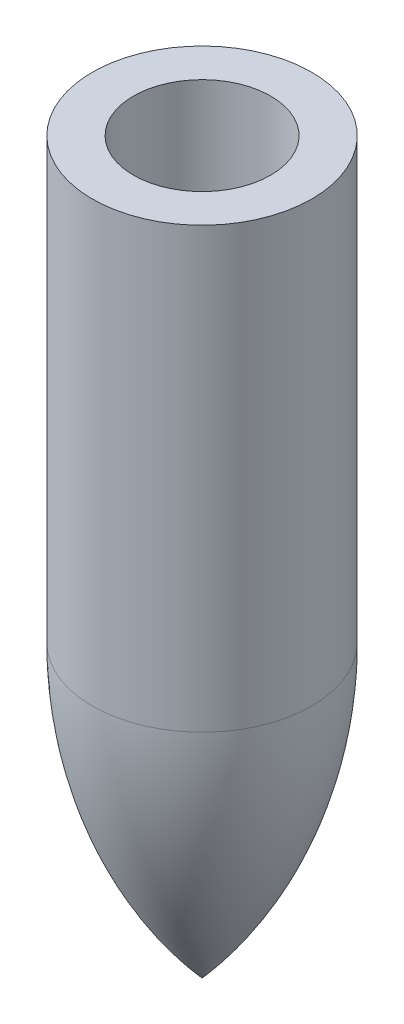
from build123d import *


# Read off the part's stored shape, not the designer's step: Shell2
with BuildPart() as part:
    # Sketch1 → Revolve1 (revolve)
    with BuildSketch(Plane.XY, mode=Mode.PRIVATE) as revolve1_sk:
        with BuildLine():
            Line((0, 0), (0, -50.8))
            ThreePointArc((0, -50.8), (3.280951188, -68.760512242), (12.7, -84.401041651))
            Line((12.7, -84.401041651), (12.7, 0))
            Line((12.7, 0), (0, 0))
        make_face()
    revolve(revolve1_sk.sketch.rotate(Axis((12.7, -84.401041651, 0), (0, 1, 0)), 180), axis=Axis((12.7, -84.401041651, 0), (0, 1, 0)))

    # Shell2 outline → Shell2 (revolve, cut)
    with BuildSketch(Plane(origin=(12.7, 0, 0), x_dir=(1, 0, 0), z_dir=(0, 0, 1))):
        with BuildLine():
            Line((0, 0), (0, -76.642627696))
            add(Edge.make_bspline(
                [(7.9375, -50.8), (7.9375, -64.940305721), (0, -76.642627696)],
                knots=[0, 0, 0, 0.596002439, 0.596002439, 0.596002439], degree=2, weights=[1, 0.95592526, 1]))
            Line((7.9375, -50.8), (7.9375, 0))
            Line((7.9375, 0), (0, 0))
        make_face()
    revolve(axis=Axis((12.7, 0, 0), (0, 1, 0)), mode=Mode.SUBTRACT)


solid = part.part
